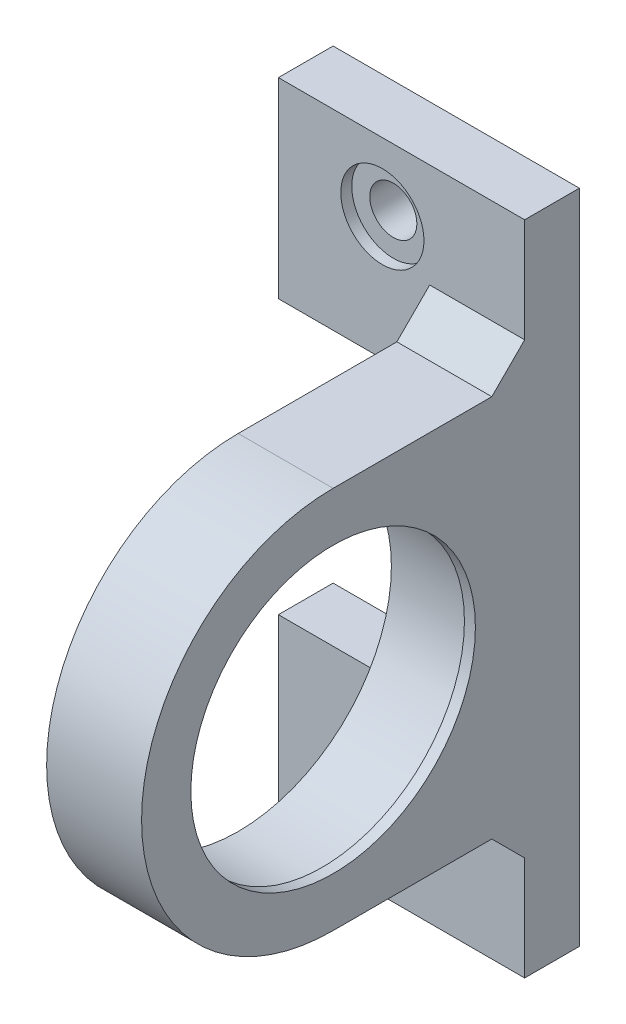
from build123d import *

# Parameters (mm, degrees)
SKETCH_2_W                     = 45
SKETCH_2_H                     = 60
SKETCH_2_W_2                   = 27.647058823
SKETCH_2_H_2                   = 25
EXTRUDE_2_DEPTH                = 5
SKETCH_4_W                     = 8.676470589
SKETCH_4_H                     = 35
SKETCH_4_W_2                   = 8.676470588
EXTRUDE_15_DEPTH               = 35
CUT_EXTRUDE_1_DEPTH            = 45
SKETCH_6_R                     = 14
CUT_EXTRUDE_2_DEPTH            = 45
FILLET_1_R                     = 5
SKETCH_7_R                     = 15
SKETCH_7_R_2                   = 13
EXTRUDE_16_DEPTH               = 1
SPLIT_BODIES_1_SURFACE_1_BACK  = 86
SPLIT_BODIES_1_SURFACE_1_DEPTH = 172
SPLIT_BODIES_1_SURFACE_2_BACK  = 86
SPLIT_BODIES_1_SURFACE_2_DEPTH = 172
HOLE_WIZARD_1_D                = 4.3
HOLE_WIZARD_1_DEPTH            = 5
HOLE_WIZARD_1_CBORE_D          = 7.6
HOLE_WIZARD_1_CBORE_DEPTH      = 1
HOLE_WIZARD_1_TIP              = 1.291850331
EXTRUDE_START                  = -1
SKETCH_14_R                    = 14
SKETCH_14_R_2                  = 13
EXTRUDE_1_DEPTH                = 1
CHAMFER_1_SIZE                 = 3


with BuildPart() as part:
    # 草图2 → 凸台-拉伸2 (new body)
    with BuildSketch(Plane.XY):
        with Locations((7.726423565, -5.661764706)):
            Rectangle(SKETCH_2_W, SKETCH_2_H)
        with Locations((7.726423565, -5.661764706)):
            Rectangle(SKETCH_2_W_2, SKETCH_2_H_2, mode=Mode.SUBTRACT)
    extrude(amount=EXTRUDE_2_DEPTH)

    # 草图4 → 凸台-拉伸15 (add)
    with BuildSketch(Plane.XY.offset(5)):
        with Locations((-10.435341141, -5.661764706)):
            Rectangle(SKETCH_4_W, SKETCH_4_H)
        with Locations((25.888188271, -5.661764706)):
            Rectangle(SKETCH_4_W_2, SKETCH_4_H)
    extrude(amount=EXTRUDE_15_DEPTH)

    # 草图5 → 切除-拉伸1 (cut)
    with BuildSketch(Plane.ZY.offset(14.773576435)):
        with BuildLine():
            ThreePointArc((22.5, 11.838235294), (34.874368671, 6.712603965), (40, -5.661764706))
            Line((40, -5.661764706), (40, 11.838235294))
            Line((40, 11.838235294), (22.5, 11.838235294))
        make_face()
        with BuildLine():
            Line((40, -23.161764706), (40, -5.661764706))
            ThreePointArc((40, -5.661764706), (34.874368671, -18.036133377), (22.5, -23.161764706))
            Line((22.5, -23.161764706), (40, -23.161764706))
        make_face()
    extrude(amount=-CUT_EXTRUDE_1_DEPTH, mode=Mode.SUBTRACT)

    # 草图6 → 切除-拉伸2 (cut)
    with BuildSketch(Plane.ZY.offset(14.773576435)):
        with Locations((22.5, -5.661764706)):
            Circle(SKETCH_6_R)
    extrude(amount=-CUT_EXTRUDE_2_DEPTH, mode=Mode.SUBTRACT)

    # 圆角1
    fillet_1_edges = [part.edges().sort_by_distance(p)[0] for p in [
        (-6.097105846, 6.838235294, 2.5),
        (21.549952977, 6.838235294, 2.5),
        (-6.097105846, -18.161764706, 2.5),
        (21.549952977, -18.161764706, 2.5),
    ]]
    fillet(fillet_1_edges, radius=FILLET_1_R)

    # 草图7 → 凸台-拉伸16 (add)
    with BuildSketch(Plane(origin=(-6.097105846, 0, 0), x_dir=(0, 0, -1), z_dir=(1, 0, 0))):
        with Locations((-22.5, -5.661764706)):
            Circle(SKETCH_7_R)
        with Locations((-22.5, -5.661764706)):
            Circle(SKETCH_7_R_2, mode=Mode.SUBTRACT)
    extrude(amount=-EXTRUDE_16_DEPTH)


with BuildPart() as body_2:
    # Split Bodies 1: the piece behind the surface
    add(part.part)
    # Split Bodies 1 surface: a surface, the sketch's curves swept straight by 172 mm
    with BuildLine(Plane.XY.offset(5).offset(-SPLIT_BODIES_1_SURFACE_1_BACK), mode=Mode.PRIVATE) as split_bodies_1_surface_1_path:
        Line((7.726423565, 24.338235294), (7.726423565, -35.661764706))
    split_bodies_1_surface_1 = Shell.extrude(split_bodies_1_surface_1_path.wire(), (0 * SPLIT_BODIES_1_SURFACE_1_DEPTH, 0 * SPLIT_BODIES_1_SURFACE_1_DEPTH, 1 * SPLIT_BODIES_1_SURFACE_1_DEPTH))
    split(bisect_by=split_bodies_1_surface_1, keep=Keep.BOTTOM)


with BuildPart() as part_1:
    add(part.part)

    # Split Bodies 1: split by a surface, the side it looks to stays
    # Split Bodies 1 surface: a surface, the sketch's curves swept straight by 172 mm
    with BuildLine(Plane.XY.offset(5).offset(-SPLIT_BODIES_1_SURFACE_2_BACK), mode=Mode.PRIVATE) as split_bodies_1_surface_2_path:
        Line((7.726423565, 24.338235294), (7.726423565, -35.661764706))
    split_bodies_1_surface_2 = Shell.extrude(split_bodies_1_surface_2_path.wire(), (0 * SPLIT_BODIES_1_SURFACE_2_DEPTH, 0 * SPLIT_BODIES_1_SURFACE_2_DEPTH, 1 * SPLIT_BODIES_1_SURFACE_2_DEPTH))
    split(bisect_by=split_bodies_1_surface_2, keep=Keep.TOP)

    # 打孔尺寸(%根据六角头螺)栓 全螺纹的类型1
    with Locations(Plane(origin=(17.226423565, 18.088235294, 5), x_dir=(1, 0, 0), z_dir=(0, 0, 1))):
        with Locations((0, 0), (0, -47.5)):
            CounterBoreHole(HOLE_WIZARD_1_D / 2, HOLE_WIZARD_1_CBORE_D / 2, HOLE_WIZARD_1_CBORE_DEPTH, depth=HOLE_WIZARD_1_DEPTH)
            with Locations((0, 0, -(HOLE_WIZARD_1_DEPTH + HOLE_WIZARD_1_TIP / 2))):  # 118° drill point
                Cone(0, HOLE_WIZARD_1_D / 2, HOLE_WIZARD_1_TIP, mode=Mode.SUBTRACT)

    # 草图14 → 拉伸-薄壁1 (add)
    with BuildSketch(Plane(origin=(30.226423565, 0, 0), x_dir=(0, 0, -1), z_dir=(1, 0, 0)).offset(EXTRUDE_START)):
        with Locations((-22.5, -5.661764706)):
            Circle(SKETCH_14_R)
        with Locations((-22.5, -5.661764706)):
            Circle(SKETCH_14_R_2, mode=Mode.SUBTRACT)
    extrude(amount=EXTRUDE_1_DEPTH)

    # 倒角1
    chamfer_1_edges = [part_1.edges().sort_by_distance(p)[0] for p in [
        (25.888188271, -23.161764706, 5),
        (25.888188271, 11.838235294, 5),
    ]]
    chamfer(chamfer_1_edges, length=CHAMFER_1_SIZE)


solid = part_1.part
